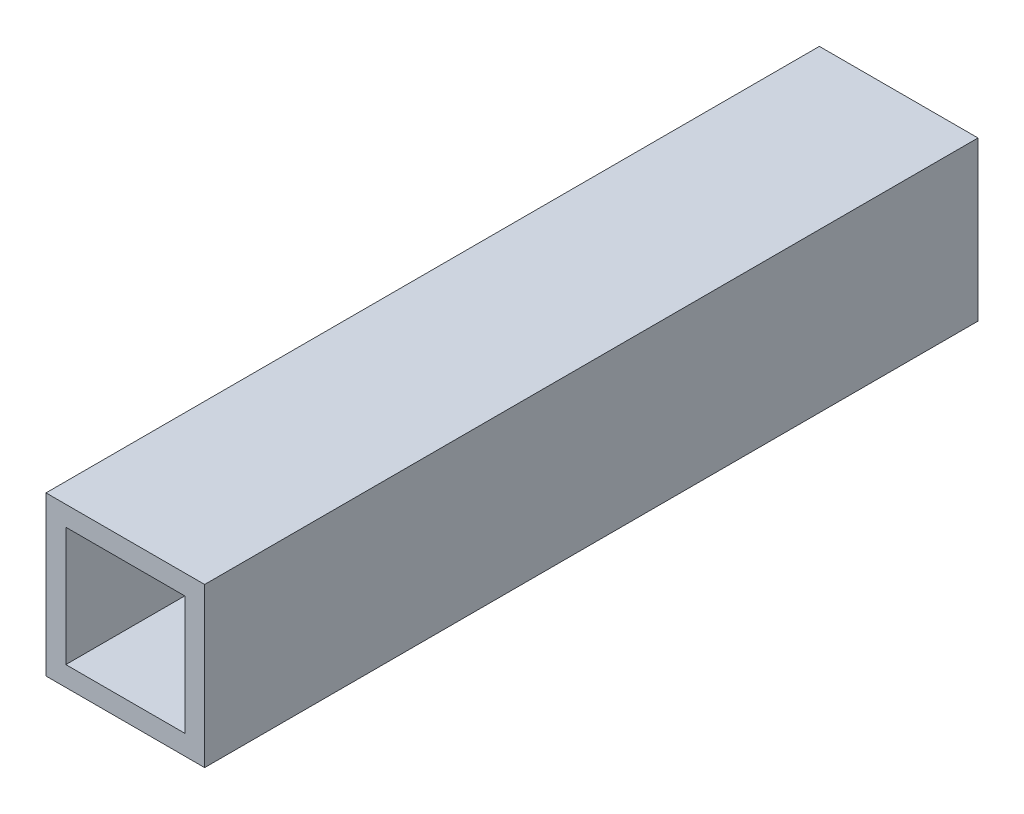
from build123d import *

# Parameters (mm, degrees)
SKETCH1_W           = 25.4
SKETCH1_H           = 25.4
BOSS_EXTRUDE1_DEPTH = 61.9125
SHELL1_T            = -3.175


with BuildPart() as part:
    # Sketch1 → Boss-Extrude1 (new, symmetric)
    with BuildSketch(Plane.XY):
        Rectangle(SKETCH1_W, SKETCH1_H)
    extrude(amount=BOSS_EXTRUDE1_DEPTH, both=True)

    # Shell1
    shell1_openings = [part.faces().sort_by_distance(p)[0] for p in [
        (0, 0, -61.9125),
        (0, 0, 61.9125),
    ]]
    offset(amount=SHELL1_T, openings=shell1_openings, kind=Kind.INTERSECTION)


solid = part.part
